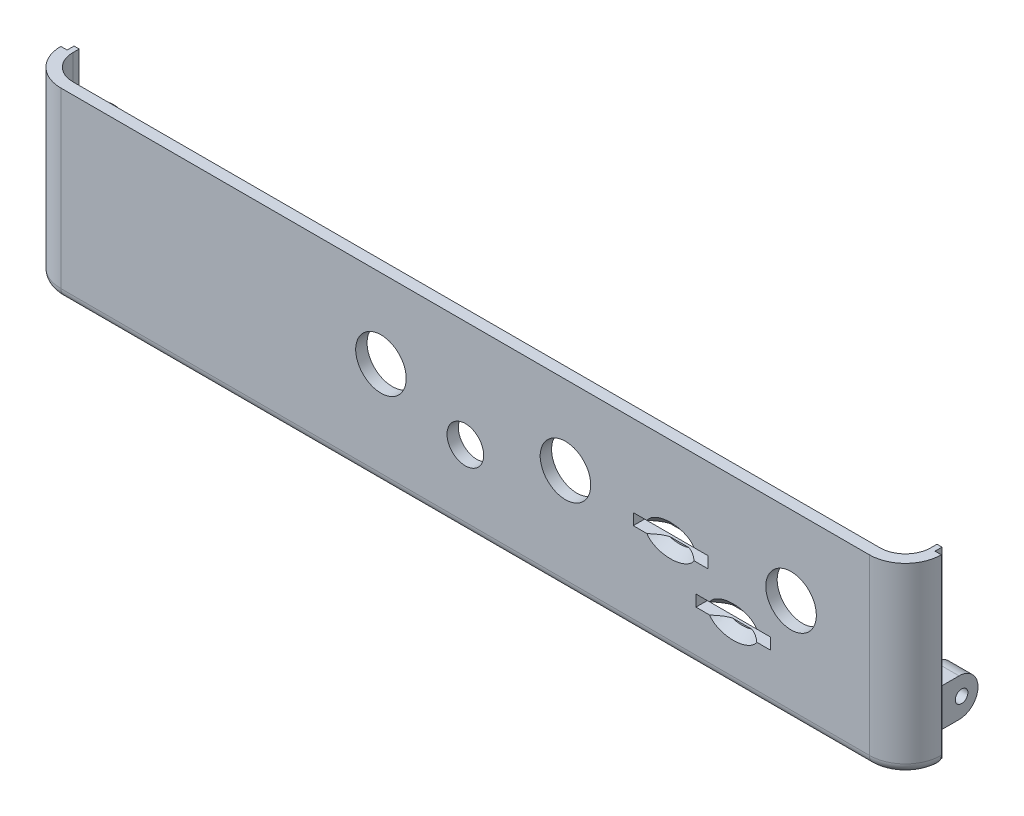
from build123d import *

# Parameters (mm, degrees)
SKETCH_2_W             = 139.4
SKETCH_2_H             = 29.1
EXTRUDE_1_DEPTH        = 1.8
SKETCH_3_R             = 2.9
SKETCH_3_R_2           = 4
SKETCH_3_W             = 11.8
SKETCH_3_H             = 1.75
SKETCH_3_W_2           = 11.80118818
SKETCH_3_H_2           = 1.8
CUT_EXTRUDE_1_DEPTH    = 1.8
SKETCH_5_W             = 1.8
SKETCH_5_H             = 29.1
SKETCH_5_H_2           = 29.5
EXTRUDE_2_DEPTH        = 5
FILLET_1_R             = 4
FILLET_2_R             = 5.7
SKETCH_9_W             = 11.8
SKETCH_9_H             = 1.8
CUT_EXTRUDE_3_DEPTH    = 1.8
SKETCH_11_RX           = 4
SKETCH_11_RY           = 2.5
CUT_EXTRUDE_5_DEPTH    = 1.4
CUT_EXTRUDE_5_TAPER    = 44
SKETCH_12_W            = 5
SKETCH_12_H            = 0.4
CUT_EXTRUDE_6_DEPTH    = 11.4
SKETCH_13_W            = 8
SKETCH_13_H            = 2
EXTRUDE_3_DEPTH        = 8
SKETCH_14_R            = 1.6
CUT_EXTRUDE_7_DEPTH    = 10
FILLET_3_R             = 3.8
EXTRUDE_1_2_DEPTH      = 1
EXTRUDE_1_2_DEPTH_BACK = 3.8
CUT_EXTRUDE_START      = -3.1
CUT_EXTRUDE_8_DEPTH    = 3.1
EXTRUDE_6_DEPTH        = 16.7
EXTRUDE_6_DEPTH_BACK   = 1.7
SKETCH_20_R            = 3.5
SKETCH_20_R_2          = 3.55
SKETCH_23_R            = 1
CUT_EXTRUDE_9_DEPTH    = 20
SKETCH_24_W            = 0.62363952
SKETCH_24_H            = 2.941002946
SKETCH_24_W_2          = 1.700851863
SKETCH_24_H_2          = 2.050645119
SKETCH_24_W_3          = 4.003246464
SKETCH_24_H_3          = 2.24108386
SKETCH_24_W_4          = 1.045953921
SKETCH_24_H_4          = 1.258351935
SKETCH_24_W_5          = 1.430643865
SKETCH_24_H_5          = 1.487953929
EXTRUDE_9_DEPTH        = 18.4
SKETCH_25_R            = 1
EXTRUDE_10_DEPTH       = 1.7
SKETCH_26_W            = 7.1
SKETCH_26_H            = 7.05
CUT_EXTRUDE_10_DEPTH   = 8
SKETCH_27_W            = 1
SKETCH_27_H            = 1.7
EXTRUDE_11_DEPTH       = 8
CHAMFER_2_SIZE         = 1
SKETCH_29_W            = 0.6
SKETCH_29_H            = 6.4
CUT_EXTRUDE_11_DEPTH   = 8
CHAMFER_3_SIZE         = 0.5
SKETCH_30_W            = 1.1
SKETCH_30_H            = 29.1
CUT_EXTRUDE_12_DEPTH   = 1
SKETCH_31_W            = 1.1
SKETCH_31_H            = 29.1
CUT_EXTRUDE_13_DEPTH   = 1
SKETCH_33_W            = 7.7
SKETCH_33_H            = 6
EXTRUDE_12_DEPTH       = 5
CUT_EXTRUDE_14_DEPTH   = 74.89438409
EXTRUDE_17_DEPTH       = 0.8
SKETCH_38_W            = 7.7
SKETCH_38_H            = 6
EXTRUDE_18_DEPTH       = 5
CUT_EXTRUDE_15_DEPTH   = 74.89438409
FILLET_5_R             = 3
SKETCH_40_R            = 1
CUT_EXTRUDE_16_DEPTH   = 138.847279625
FILLET_6_R             = 1.6


# Some blends are built 0.0001 mm under size
with BuildPart() as part:
    # Эскиз2 → Extrude 1 (new body)
    with BuildSketch(Plane.XY):
        with Locations((0, -0.8)):
            Rectangle(SKETCH_2_W, SKETCH_2_H)
    extrude(amount=EXTRUDE_1_DEPTH)

    # Эскиз3 → Вырез-Вытянуть1 (cut)
    with BuildSketch(Plane.XY.offset(1.8)):
        with Locations((0.041688905, -3.136515182)):
            Circle(SKETCH_3_R)
        with Locations((-13.318733333, 1.25)):
            Circle(SKETCH_3_R_2)
        with Locations((15.891266667, 1.25)):
            Circle(SKETCH_3_R_2)
        with Locations((51.610033333, 1.25)):
            Circle(SKETCH_3_R_2)
        with Locations((32.523766667, -0.045)):
            Rectangle(SKETCH_3_W, SKETCH_3_H)
        with Locations((42.450563466, -6.25)):
            Rectangle(SKETCH_3_W_2, SKETCH_3_H_2)
    extrude(amount=-CUT_EXTRUDE_1_DEPTH, mode=Mode.SUBTRACT)

    # Эскиз5 → Бобышка-Вытянуть2 (add)
    with BuildSketch(Plane(origin=(0, 0, 0), x_dir=(-1, 0, 0), z_dir=(0, 0, -1))):
        with Locations((68.8, -0.8)):
            Rectangle(SKETCH_5_W, SKETCH_5_H)
        with Locations((-68.8, -1)):
            Rectangle(SKETCH_5_W, SKETCH_5_H_2)
    extrude(amount=EXTRUDE_2_DEPTH)

    # Скругление1
    fillet_1_edges = [part.edges().sort_by_distance(p)[0] for p in [
        (-67.9, -0.8, 0),
        (67.9, -0.8, 0),
    ]]
    fillet(fillet_1_edges, radius=FILLET_1_R)

    # Скругление2
    fillet_2_edges = [part.edges().sort_by_distance(p)[0] for p in [
        (69.7, -0.8, 1.8),
        (-69.7, -0.8, 1.8),
    ]]
    fillet(fillet_2_edges, radius=FILLET_2_R)

    # Эскиз9 → Вырез-Вытянуть3 (cut)
    with BuildSketch(Plane.XY.offset(1.8)):
        with Locations((32.523766667, -0.045)):
            Rectangle(SKETCH_9_W, SKETCH_9_H)
    extrude(amount=-CUT_EXTRUDE_3_DEPTH, mode=Mode.SUBTRACT)

    # Эскиз11 → Вырез-Вытянуть5 (cut)
    with BuildSketch(Plane.XY.offset(1.8)):
        with Locations(Location((32.523766667, -0.045), (0, 0, 180))):
            Ellipse(SKETCH_11_RX, SKETCH_11_RY)
        with Locations(Location((42.451157556, -6.25), (0, 0, -180))):
            Ellipse(SKETCH_11_RX, SKETCH_11_RY)
    extrude(amount=-CUT_EXTRUDE_5_DEPTH, taper=CUT_EXTRUDE_5_TAPER, mode=Mode.SUBTRACT)

    # Эскиз12 → Вырез-Вытянуть6 (cut)
    with BuildSketch(Plane.ZY.offset(-67.9)):
        with Locations((-2.5, -15.55)):
            Rectangle(SKETCH_12_W, SKETCH_12_H)
    extrude(amount=-CUT_EXTRUDE_6_DEPTH, mode=Mode.SUBTRACT)

    # Эскиз13 → Бобышка-Вытянуть3 (add)
    with BuildSketch(Plane(origin=(0, 0, 0), x_dir=(-1, 0, 0), z_dir=(0, 0, -1))):
        with Locations((-56.7, -5.95)):
            Rectangle(SKETCH_13_W, SKETCH_13_H)
        with Locations((56.7, -5.95)):
            Rectangle(SKETCH_13_W, SKETCH_13_H)
    extrude(amount=EXTRUDE_3_DEPTH)

    # Эскиз14 → Вырез-Вытянуть7 (cut)
    with BuildSketch(Plane(origin=(0, -4.95, 0), x_dir=(1, 0, 0), z_dir=(0, 1, 0))):
        with Locations(Location((-56.7, 4.3, 0), (0, 0, 270))):
            Circle(SKETCH_14_R)
        with Locations(Location((56.7, 4.3, 0), (0, 0, 270))):
            Circle(SKETCH_14_R)
    extrude(amount=-CUT_EXTRUDE_7_DEPTH, mode=Mode.SUBTRACT)

    # Скругление3
    # the kernel refuses this fillet: 3.8 mm, written as the material it adds along each edge
    with BuildSketch(Plane(origin=(60.7, -6.95, 0), x_dir=(1, 0, 0), z_dir=(0, 1, 0)), Plane(origin=(52.7, -4.95, 0), x_dir=(-1, 0, 0), z_dir=(0, -1, 0)), Plane(origin=(-52.7, -6.95, 0), x_dir=(1, 0, 0), z_dir=(0, 1, 0)), Plane(origin=(-60.7, -4.95, 0), x_dir=(-1, 0, 0), z_dir=(0, -1, 0))) as fillet_3_piece_1:
        with BuildLine():
            CenterArc((FILLET_3_R, FILLET_3_R), FILLET_3_R, 180, 90)
            Line((0, FILLET_3_R), (0, 0))
            Line((0, 0), (FILLET_3_R, 0))
        make_face()
    extrude(amount=2)
    # the kernel refuses this fillet: 3.8 mm, written as the material it takes off along each edge
    with BuildSketch(Plane(origin=(60.7, -16.45, -8), x_dir=(-1, 0, 0), z_dir=(0, 1, 0)), Plane(origin=(-60.7, 4.55, -8), x_dir=(1, 0, 0), z_dir=(0, -1, 0))) as fillet_3_2_piece_1:
        with BuildLine():
            CenterArc((FILLET_3_R, FILLET_3_R), FILLET_3_R, 180, 90)
            Line((0, FILLET_3_R), (0, 0))
            Line((0, 0), (FILLET_3_R, 0))
        make_face()
    extrude(amount=21, mode=Mode.SUBTRACT)
    with BuildSketch(Plane(origin=(52.7, 4.55, -8), x_dir=(0, 0, 1), z_dir=(0, -1, 0)), Plane(origin=(-52.7, -16.45, -8), x_dir=(0, 0, 1), z_dir=(0, 1, 0))) as fillet_3_2_piece_2:
        with BuildLine():
            CenterArc((FILLET_3_R, -FILLET_3_R), FILLET_3_R, 90, 90)
            Line((0, -FILLET_3_R), (0, 0))
            Line((0, 0), (FILLET_3_R, 0))
        make_face()
    extrude(amount=21, mode=Mode.SUBTRACT)

    # Эскиз18 → Extrude 1 2 (add, two sides: drawn at the far end of the back side and taken through both)
    with BuildSketch(Plane.XZ.offset(15.35).offset(-EXTRUDE_1_2_DEPTH_BACK)):
        with BuildLine():
            Line((-67.9, -5), (-67.9, -4))
            ThreePointArc((-67.9, -4), (-66.728427125, -1.171572875), (-63.9, 0))
            Line((-63.9, 0), (63.9, 0))
            ThreePointArc((63.9, 0), (66.728427125, -1.171572875), (67.9, -4))
            Line((67.9, -4), (67.9, -5))
            Line((67.9, -5), (66.9, -5))
            Line((66.9, -5), (66.9, -4))
            ThreePointArc((66.9, -4), (66.021320344, -1.878679656), (63.9, -1))
            Line((63.9, -1), (-63.9, -1))
            ThreePointArc((-63.9, -1), (-66.021320344, -1.878679656), (-66.9, -4))
            Line((-66.9, -4), (-66.9, -5))
            Line((-66.9, -5), (-67.9, -5))
        make_face()
    extrude(amount=EXTRUDE_1_2_DEPTH + EXTRUDE_1_2_DEPTH_BACK)

    # Эскиз19 → Вырез-Вытянуть8 (cut)
    with BuildSketch(Plane.XZ.offset(16.35).offset(CUT_EXTRUDE_START)):
        with BuildLine():
            Line((66.9, -4), (66.9, -5))
            Line((66.9, -5), (67.9, -5))
            Line((67.9, -5), (67.9, -4))
            ThreePointArc((67.9, -4), (66.728427125, -1.171572875), (63.9, 0))
            Line((63.9, 0), (-63.9, 0))
            ThreePointArc((-63.9, 0), (-66.728427125, -1.171572875), (-67.9, -4))
            Line((-67.9, -4), (-67.9, -5))
            Line((-67.9, -5), (-66.9, -5))
            Line((-66.9, -5), (-66.9, -4))
            ThreePointArc((-66.9, -4), (-66.021320344, -1.878679656), (-63.9, -1))
            Line((-63.9, -1), (63.9, -1))
            ThreePointArc((63.9, -1), (66.021320344, -1.878679656), (66.9, -4))
        make_face()
    extrude(amount=CUT_EXTRUDE_8_DEPTH, mode=Mode.SUBTRACT)

    # Эскиз20 → Бобышка-Вытянуть6 (add, two sides: drawn at the far end of the back side and taken through both)
    with BuildSketch(Plane(origin=(0, -11.55, 0), x_dir=(1, 0, 0), z_dir=(0, 1, 0)).offset(-EXTRUDE_6_DEPTH_BACK)):
        with Locations((-64.4, 3.5)):
            Circle(SKETCH_20_R)
        with Locations((64.4, 3.5)):
            Circle(SKETCH_20_R)
        with Locations((-26, 3.5)):
            Circle(SKETCH_20_R_2)
    extrude(amount=EXTRUDE_6_DEPTH + EXTRUDE_6_DEPTH_BACK)

    # Эскиз23 → Вырез-Вытянуть9 (cut)
    with BuildSketch(Plane(origin=(0, 5.15, 0), x_dir=(1, 0, 0), z_dir=(0, 1, 0))):
        with Locations(Location((-64.4, 3.5, 0), (0, 0, 270))):
            Circle(SKETCH_23_R)
        with Locations(Location((-26, 3.5, 0), (0, 0, 270))):
            Circle(SKETCH_23_R)
        with Locations(Location((64.4, 3.5, 0), (0, 0, 270))):
            Circle(SKETCH_23_R)
    extrude(amount=-CUT_EXTRUDE_9_DEPTH, mode=Mode.SUBTRACT)

    # Эскиз24 → Бобышка-Вытянуть9 (add)
    with BuildSketch(Plane(origin=(0, 5.15, 0), x_dir=(1, 0, 0), z_dir=(0, 1, 0))):
        with Locations((-67.58818024, 3.529498527)):
            Rectangle(SKETCH_24_W, SKETCH_24_H)
        Polygon((-60.9, -0.98216772), (-60.9, 3.5), (-62.457500072, 3.5), (-62.457500072, 2.058997054), (-62.457500072, 0.008351935), (-62.457500072, -0.98216772), align=None)
        with Locations((-63.307926004, 1.033674495)):
            Rectangle(SKETCH_24_W_2, SKETCH_24_H_2)
        Polygon((-28.283629168, 3.5), (-29.55, 3.5), (-29.55, -0.98216772), (-28.283629168, -0.98216772), (-28.283629168, 1.25891614), align=None)
        with Locations((-26.282005936, 0.13837421)):
            Rectangle(SKETCH_24_W_3, SKETCH_24_H_3)
        Polygon((-24.280382704, 3.5), (-24.280382704, 1.25891614), (-24.280382704, -0.98216772), (-22.45, -0.98216772), (-22.45, 3.5), align=None)
        with Locations((67.368671105, 4.370824032)):
            Rectangle(SKETCH_24_W_4, SKETCH_24_H_4)
        Polygon((62.72770807, 3.5), (60.9, 3.5), (60.9, -0.98216772), (62.72770807, -0.98216772), (62.72770807, 0.008351935), (62.72770807, 1.496305864), align=None)
        with Locations((63.443030003, 0.7523289)):
            Rectangle(SKETCH_24_W_5, SKETCH_24_H_5)
    extrude(amount=-EXTRUDE_9_DEPTH)

    # Эскиз25 → Бобышка-Вытянуть10 (add)
    with BuildSketch(Plane(origin=(0, 5.15, 0), x_dir=(1, 0, 0), z_dir=(0, 1, 0))):
        with BuildLine():
            Line((-64.158351935, 0.008351935), (-62.457500072, 0.008351935))
            Line((-62.457500072, 0.008351935), (-62.457500072, 0))
            Line((-62.457500072, 0), (-60.9, 0))
            Line((-60.9, 0), (-60.9, 3.5))
            ThreePointArc((-60.9, 3.5), (-63.631225589, 6.914525722), (-67.56227766, 5))
            Line((-67.56227766, 5), (-67.9, 5))
            Line((-67.9, 5), (-67.9, 4))
            ThreePointArc((-67.9, 4), (-66.818339231, 1.264438608), (-64.158351935, 0.008351935))
        make_face()
        with Locations(Location((-64.4, 3.5, 0), (0, 0, 270))):
            Circle(SKETCH_25_R, mode=Mode.SUBTRACT)
    extrude(amount=EXTRUDE_10_DEPTH)

    # Эскиз26 → Вырез-Вытянуть10 (cut)
    with BuildSketch(Plane.XZ.offset(13.25)):
        with Locations((-26, -3.525)):
            Rectangle(SKETCH_26_W, SKETCH_26_H)
    extrude(amount=-CUT_EXTRUDE_10_DEPTH, mode=Mode.SUBTRACT)

    # Эскиз27 → Бобышка-Вытянуть11 (add)
    with BuildSketch(Plane(origin=(-29.55, 0, 0), x_dir=(0, 0, -1), z_dir=(1, 0, 0))):
        with Locations((0.5, -12.4)):
            Rectangle(SKETCH_27_W, SKETCH_27_H)
    extrude(amount=EXTRUDE_11_DEPTH)

    # Фаска2
    chamfer_2_edges = [part.edges().sort_by_distance(p)[0] for p in [
        (0, -11.55, 0),
    ]]
    chamfer(chamfer_2_edges, length=CHAMFER_2_SIZE - 0.0001)  # a hair under: the kernel refuses the full size

    # Эскиз29 → Вырез-Вытянуть11 (cut)
    with BuildSketch(Plane(origin=(69.7, 0, 0), x_dir=(0, 0, -1), z_dir=(1, 0, 0))):
        with Locations((6.75, 1.95)):
            Rectangle(SKETCH_29_W, SKETCH_29_H)
    extrude(amount=-CUT_EXTRUDE_11_DEPTH, mode=Mode.SUBTRACT)

    # Фаска3
    chamfer_3_edges = [part.edges().sort_by_distance(p)[0] for p in [
        (64.4, -1.25, -7),
    ]]
    chamfer(chamfer_3_edges, length=CHAMFER_3_SIZE)

    # Эскиз30 → Вырез-Вытянуть12 (cut)
    with BuildSketch(Plane(origin=(69.7, 0, 0), x_dir=(0, 0, -1), z_dir=(1, 0, 0))):
        with Locations((4.45, -0.8)):
            Rectangle(SKETCH_30_W, SKETCH_30_H)
    extrude(amount=-CUT_EXTRUDE_12_DEPTH, mode=Mode.SUBTRACT)

    # Эскиз31 → Вырез-Вытянуть13 (cut)
    with BuildSketch(Plane.ZY.offset(69.7)):
        with Locations((-4.45, -0.8)):
            Rectangle(SKETCH_31_W, SKETCH_31_H)
    extrude(amount=-CUT_EXTRUDE_13_DEPTH, mode=Mode.SUBTRACT)

    # Эскиз33 → Бобышка-Вытянуть12 (add)
    with BuildSketch(Plane(origin=(-67.9, 0, 0), x_dir=(0, 0, -1), z_dir=(1, 0, 0))):
        with Locations((8.85, -10.25)):
            Rectangle(SKETCH_33_W, SKETCH_33_H)
    extrude(amount=EXTRUDE_12_DEPTH)

    # Эскиз34 → Вырез-Вытянуть14 (cut, through all)
    with BuildSketch(Plane(origin=(0, -7.25, 0), x_dir=(1, 0, 0), z_dir=(0, 1, 0))):
        with BuildLine():
            Line((-66.7, 12.7), (-67.9, 12.7))
            Line((-67.9, 12.7), (-67.9, 5))
            Line((-67.9, 5), (-67.56227766, 5))
            ThreePointArc((-67.56227766, 5), (-67.189799888, 5.61353178), (-66.7, 6.138181192))
            Line((-66.7, 6.138181192), (-66.7, 12.7))
        make_face()
    extrude(amount=-CUT_EXTRUDE_14_DEPTH, mode=Mode.SUBTRACT)

    # Эскиз37 → Бобышка-Вытянуть17 (add)
    with BuildSketch(Plane(origin=(0, 0, -5), x_dir=(-1, 0, 0), z_dir=(0, 0, -1))):
        Polygon((-68.7, -15.35), (-68.7, 13.75), (-67.9, 13.75), (-67.891648065, 5.15), (-67.56227766, 5.15), (-67.56227766, -13.25), (-67.9, -13.25), (-67.9, -15.35), align=None)
    extrude(amount=-EXTRUDE_17_DEPTH)

    # Эскиз38 → Бобышка-Вытянуть18 (add)
    with BuildSketch(Plane.ZY.offset(-67.9)):
        with Locations((-8.85, -10.25)):
            Rectangle(SKETCH_38_W, SKETCH_38_H)
    extrude(amount=EXTRUDE_18_DEPTH)

    # Эскиз39 → Вырез-Вытянуть15 (cut, through all)
    with BuildSketch(Plane(origin=(0, -7.25, 0), x_dir=(1, 0, 0), z_dir=(0, 1, 0))):
        with BuildLine():
            Line((67.56227766, 5), (67.9, 5))
            Line((67.9, 5), (67.9, 12.7))
            Line((67.9, 12.7), (66.7, 12.7))
            Line((66.7, 12.7), (66.7, 6.138181192))
            ThreePointArc((66.7, 6.138181192), (67.189799888, 5.61353178), (67.56227766, 5))
        make_face()
    extrude(amount=-CUT_EXTRUDE_15_DEPTH, mode=Mode.SUBTRACT)

    # Скругление5
    fillet_5_edges = [part.edges().sort_by_distance(p)[0] for p in [
        (64.8, -13.25, -12.7),
        (64.8, -7.25, -12.7),
        (-64.8, -7.25, -12.7),
        (-64.8, -13.25, -12.7),
    ]]
    fillet(fillet_5_edges, radius=FILLET_5_R - 0.0001)  # a hair under: the kernel refuses the full size

    # Эскиз40 → Вырез-Вытянуть16 (cut, through all)
    with BuildSketch(Plane.ZY.offset(66.7)):
        with Locations((-10.1, -10.25)):
            Circle(SKETCH_40_R)
    extrude(amount=-CUT_EXTRUDE_16_DEPTH, mode=Mode.SUBTRACT)

    # Скругление6
    # the kernel refuses this fillet: 1.6 mm, written as the material it takes off along each edge
    with BuildSketch(Plane(origin=(-64, -15.35, -3.9), x_dir=(0, 0, 1), z_dir=(1, 0, 0))) as fillet_6_piece_1:
        with BuildLine():
            CenterArc((5.7 - FILLET_6_R, -FILLET_6_R), FILLET_6_R, 0, 90)
            Line((5.7, -FILLET_6_R), (5.7, 0))
            Line((5.7, 0), (5.7 - FILLET_6_R, 0))
        make_face()
    revolve(axis=Axis((-64, -15.35, -3.9), (0, -1, 0)), revolution_arc=130.223716277, mode=Mode.SUBTRACT)
    with BuildSketch(Plane(origin=(64, -15.35, -3.9), x_dir=(0, 0, 1), z_dir=(-1, 0, 0))) as fillet_6_piece_2:
        with BuildLine():
            CenterArc((5.7 - FILLET_6_R, FILLET_6_R), FILLET_6_R, 270, 90)
            Line((5.7, FILLET_6_R), (5.7, 0))
            Line((5.7, 0), (5.7 - FILLET_6_R, 0))
        make_face()
    revolve(axis=Axis((64, -15.35, -3.9), (0, 1, 0)), revolution_arc=130.223716277, mode=Mode.SUBTRACT)
    with BuildSketch(Plane(origin=(64, -15.35, 1.8), x_dir=(0, 0, -1), z_dir=(-1, 0, 0))) as fillet_6_piece_3:
        with BuildLine():
            CenterArc((FILLET_6_R, -FILLET_6_R), FILLET_6_R, 90, 90)
            Line((0, -FILLET_6_R), (0, 0))
            Line((0, 0), (FILLET_6_R, 0))
        make_face()
    extrude(amount=128, mode=Mode.SUBTRACT)


solid = part.part
